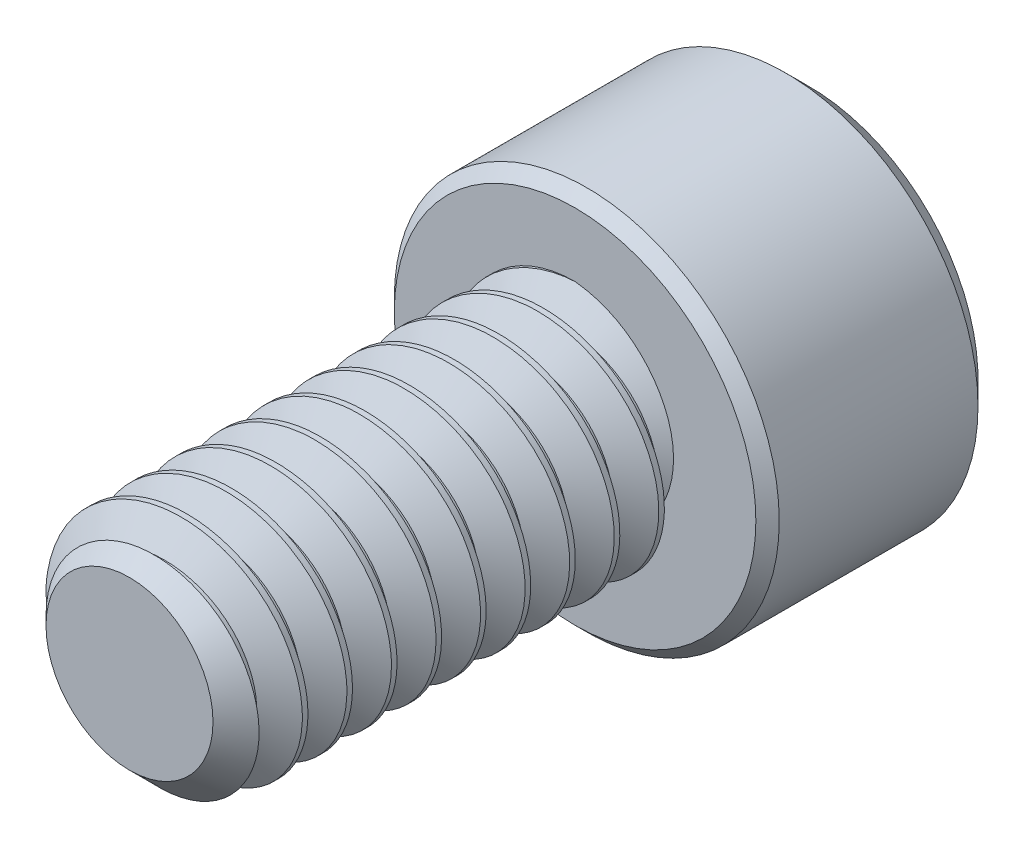
from build123d import *

# Parameters (mm, degrees)
SKETCH1_R          = 2.0828
EXTRUDE1_DEPTH     = 7.9375
CHAMFER3_SIZE      = 0.5953125
CUT_SWEEP1_PITCH   = 0.79375
SKETCH6_R          = 3.429
EXTRUDE2_DEPTH     = 4.1656
CUT_EXTRUDE1_DEPTH = 2.67890625
SKETCH8_R          = 2.062222993
CUT_EXTRUDE2_DEPTH = 0.41656
CUT_EXTRUDE2_DRAFT = -45
CHAMFER1_SIZE      = 0.41656
CHAMFER2_SIZE      = 0.20828


with BuildPart() as part:
    # Sketch1 → Extrude1 (new body)
    with BuildSketch(Plane.XY):
        Circle(SKETCH1_R)
    extrude(amount=-EXTRUDE1_DEPTH)

    # Chamfer3
    chamfer3_edges = [part.edges().sort_by_distance(p)[0] for p in [
        (-2.0828, 0, 0),
    ]]
    chamfer(chamfer3_edges, length=CHAMFER3_SIZE)

    # Cut-Sweep1: the profile of Sketch3 profile screwed along a right-hand helix of 11 turns, 6 arcs to a turn; built about Z, then put on its axis
    cut_sweep1_z = Axis((0, 0, 0), (0, 0, 1))
    cut_sweep1_corners = [(2.0831, 0, -0.694704455), (1.567244252, 0, -0.396875), (1.567244252, 0, -0.29765625), (2.0831, 0, 0.000173205)]
    with BuildLine(mode=Mode.PRIVATE) as cut_sweep1_profile:
        Line(cut_sweep1_corners[0], cut_sweep1_corners[1])
        Line(cut_sweep1_corners[1], cut_sweep1_corners[2])
        Line(cut_sweep1_corners[2], cut_sweep1_corners[3])
        Line(cut_sweep1_corners[3], cut_sweep1_corners[0])
    cut_sweep1_cap = Face(cut_sweep1_profile.wire())
    cut_sweep1_turn_angles = [0, 30, 60, 90, 120, 150, 180, 210, 240, 270, 300, 330, 360]
    cut_sweep1_turn_weights = [1, 0.8660254037844387, 1, 0.8660254037844387, 1, 0.8660254037844387, 1, 0.8660254037844387, 1, 0.8660254037844387, 1, 0.8660254037844387, 1]
    cut_sweep1_turn_rails = [Edge.make_bspline([Vector(p[0], p[1], 0).rotate(cut_sweep1_z, cut_sweep1_turn_angles[k]) / cut_sweep1_turn_weights[k] + Vector(0, 0, p[2] + CUT_SWEEP1_PITCH * cut_sweep1_turn_angles[k] / 360) for k in range(13)], [0, 0, 0, 1, 1, 2, 2, 3, 3, 4, 4, 5, 5, 6, 6, 6], 2, cut_sweep1_turn_weights) for p in cut_sweep1_corners]
    cut_sweep1_turn_sides = [Face.make_surface_from_curves(cut_sweep1_turn_rails[p[0]], cut_sweep1_turn_rails[p[1]]) for p in [(0, 1), (1, 2), (2, 3), (3, 0)]]
    cut_sweep1 = Plane(origin=(0, 0, 0), x_dir=(0, 1, 0), z_dir=(0, 0, -1)) * Solid(Shell([*[p.moved(Location((0, 0, CUT_SWEEP1_PITCH * i))) for i in range(11) for p in cut_sweep1_turn_sides], cut_sweep1_cap, cut_sweep1_cap.rotate(cut_sweep1_z, 3960).moved(Location((0, 0, CUT_SWEEP1_PITCH * 3960 / 360)))]))
    add(cut_sweep1, mode=Mode.SUBTRACT)

    # Sketch6 → Extrude2 (add)
    with BuildSketch(Plane(origin=(0, 0, -7.9375), x_dir=(-1, 0, 0), z_dir=(0, 0, -1))):
        Circle(SKETCH6_R)
    extrude(amount=EXTRUDE2_DEPTH)

    # Sketch7 → Cut-Extrude1 (cut)
    with BuildSketch(Plane(origin=(0, 0, -12.1031), x_dir=(-1, 0, 0), z_dir=(0, 0, -1))):
        Polygon((0, 2.062222993), (-1.7859375, 1.031111496), (-1.7859375, -1.031111496), (0, -2.062222993), (1.7859375, -1.031111496), (1.7859375, 1.031111496), align=None)
    extrude(amount=-CUT_EXTRUDE1_DEPTH, mode=Mode.SUBTRACT)


with BuildPart() as cut_extrude2_tool:
    # Sketch8 → Cut-Extrude2 (with draft: the straight prism first)
    with BuildSketch(Plane(origin=(0, 0, -12.1031), x_dir=(-1, 0, 0), z_dir=(0, 0, -1))):
        Circle(SKETCH8_R)
    extrude(amount=-CUT_EXTRUDE2_DEPTH)
    # Cut-Extrude2: the draft: its side faces are tilted about the plane it starts from
    cut_extrude2_sides = [cut_extrude2_tool.faces().sort_by_distance(p)[0] for p in [
        (2.062222993, 0, -11.89482),
    ]]
    draft(cut_extrude2_sides, Plane(origin=(0, 0, -12.1031), x_dir=(-1, 0, 0), z_dir=(0, 0, -1)), CUT_EXTRUDE2_DRAFT)


with BuildPart() as part_1:
    add(part.part)

    # Cut-Extrude2: cut by cut_extrude2_tool
    add(cut_extrude2_tool.part, mode=Mode.SUBTRACT)

    # Chamfer1
    chamfer1_edges = [part_1.edges().sort_by_distance(p)[0] for p in [
        (3.429, 0, -12.1031),
    ]]
    chamfer(chamfer1_edges, length=CHAMFER1_SIZE)

    # Chamfer2
    chamfer2_edges = [part_1.edges().sort_by_distance(p)[0] for p in [
        (3.429, 0, -7.9375),
    ]]
    chamfer(chamfer2_edges, length=CHAMFER2_SIZE)


solid = part_1.part
